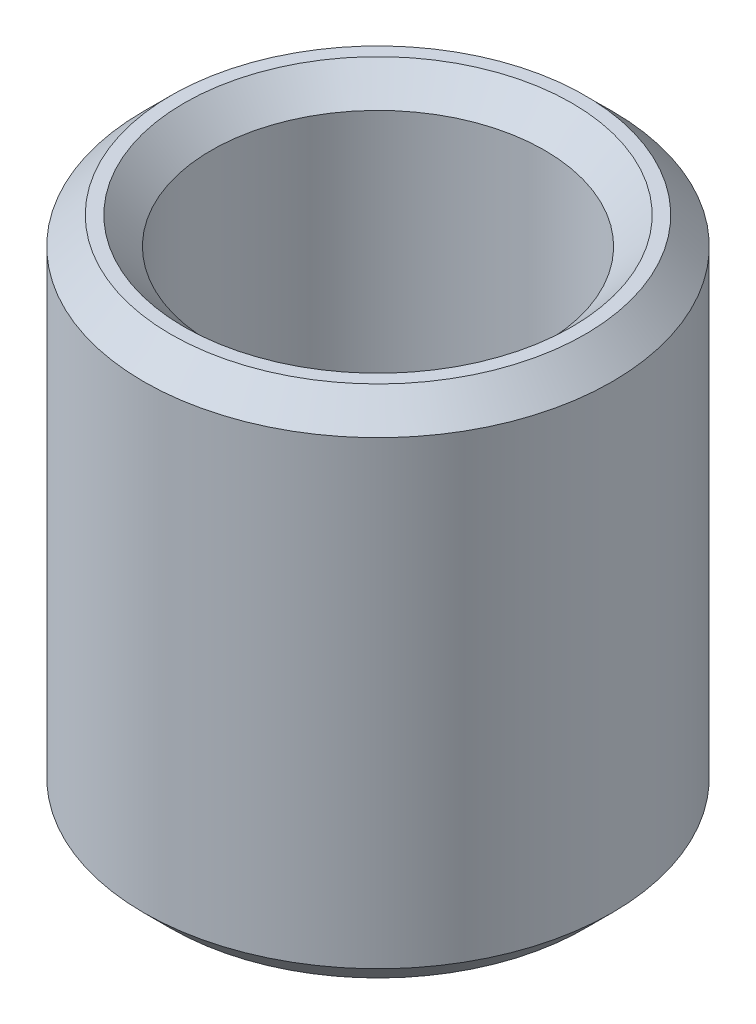
from build123d import *

# Parameters (mm, degrees)
SKETCH1_R           = 10
BOSS_EXTRUDE1_DEPTH = 21.959565877
SKETCH2_R           = 7.112266087
CUT_EXTRUDE1_DEPTH  = 27.119389991
CHAMFER1_SIZE       = 1.163476284


with BuildPart() as part:
    # Sketch1 → Boss-Extrude1 (new body)
    with BuildSketch(Plane(origin=(0, 0, 0), x_dir=(1, 0, 0), z_dir=(0, 1, 0))):
        Circle(SKETCH1_R)
    extrude(amount=BOSS_EXTRUDE1_DEPTH)

    # Sketch2 → Cut-Extrude1 (cut, through all)
    with BuildSketch(Plane(origin=(0, 0, 0), x_dir=(1, 0, 0), z_dir=(0, 1, 0))):
        Circle(SKETCH2_R)
    extrude(amount=CUT_EXTRUDE1_DEPTH, mode=Mode.SUBTRACT)

    # Chamfer1
    chamfer1_edges = [part.edges().sort_by_distance(p)[0] for p in [
        (-7.112266087, 21.959565877, 0),
        (-7.112266087, 0, 0),
        (-10, 0, 0),
        (-10, 21.959565877, 0),
    ]]
    chamfer(chamfer1_edges, length=CHAMFER1_SIZE)


solid = part.part
